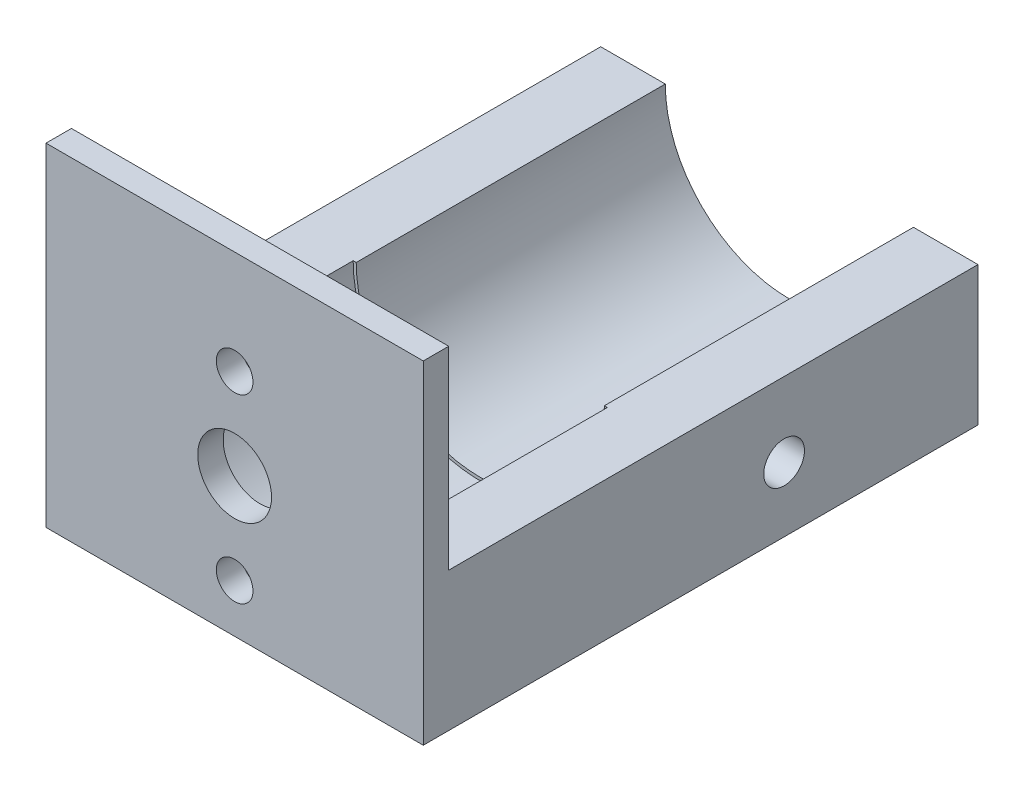
from build123d import *

# Parameters (mm, degrees)
BOSS_EXTRUDE1_DEPTH = 30.364999976
BOSS_EXTRUDE2_DEPTH = 21.63499991
SKETCH4_W           = 37.064796383
SKETCH4_H           = 32.7
SKETCH4_R           = 3.625
SKETCH4_R_2         = 1.8
BOSS_EXTRUDE3_DEPTH = 2.5
SKETCH5_R           = 2
CUT_EXTRUDE1_DEPTH  = 7
SKETCH6_R           = 2.000000064
CUT_EXTRUDE2_DEPTH  = 7
CUT_EXTRUDE3_START  = -7
SKETCH7_R           = 2
CUT_EXTRUDE3_DEPTH  = 7


with BuildPart() as part:
    # Sketch1 → Boss-Extrude1 (new body)
    with BuildSketch(Plane.XY):
        with BuildLine():
            Line((23.763847258, 19.05), (23.763847258, 5.4))
            Line((23.763847258, 5.4), (-13.300949125, 5.4))
            Line((-13.300949125, 5.4), (-13.300949125, 19.05))
            Line((-13.300949125, 19.05), (-6.958949124, 19.05))
            ThreePointArc((-6.958949124, 19.05), (5.231449067, 6.859601809), (17.421847257, 19.05))
            Line((17.421847257, 19.05), (23.763847258, 19.05))
        make_face()
    extrude(amount=BOSS_EXTRUDE1_DEPTH)

    # Sketch3 → Boss-Extrude2 (add)
    with BuildSketch(Plane.XY.offset(30.364999976)):
        with BuildLine():
            Line((-13.300949125, 19.05), (-13.300949125, 5.4))
            Line((-13.300949125, 5.4), (23.763847258, 5.4))
            Line((23.763847258, 5.4), (23.763847258, 19.05))
            Line((23.763847258, 19.05), (17.72184715, 19.05))
            ThreePointArc((17.72184715, 19.05), (5.231449012, 6.559601862), (-7.258949126, 19.05))
            Line((-7.258949126, 19.05), (-13.300949125, 19.05))
        make_face()
    extrude(amount=BOSS_EXTRUDE2_DEPTH)

    # Sketch4 → Boss-Extrude3 (add)
    with BuildSketch(Plane.XY.offset(51.999999886)):
        with Locations((5.231449067, 21.75)):
            Rectangle(SKETCH4_W, SKETCH4_H)
        with Locations((5.231449093, 19.05)):
            Circle(SKETCH4_R, mode=Mode.SUBTRACT)
        with Locations((5.231449093, 10.16)):
            Circle(SKETCH4_R_2, mode=Mode.SUBTRACT)
        with Locations((5.231449093, 27.94)):
            Circle(SKETCH4_R_2, mode=Mode.SUBTRACT)
    extrude(amount=BOSS_EXTRUDE3_DEPTH)

    # Sketch5 → Cut-Extrude1 (cut)
    with BuildSketch(Plane.XZ.offset(-5.4)):
        with Locations((-8.220949125, 48.149999886)):
            Circle(SKETCH5_R)
        with Locations((18.683847258, 48.149999886)):
            Circle(SKETCH5_R)
        with Locations((-8.220949125, 6.35)):
            Circle(SKETCH5_R)
        with Locations((18.683847258, 6.35)):
            Circle(SKETCH5_R)
    extrude(amount=-CUT_EXTRUDE1_DEPTH, mode=Mode.SUBTRACT)

    # Sketch6 → Cut-Extrude2 (cut)
    with BuildSketch(Plane.ZY.offset(13.300949125)):
        with Locations((19.05, 11.75)):
            Circle(SKETCH6_R)
    extrude(amount=-CUT_EXTRUDE2_DEPTH, mode=Mode.SUBTRACT)

    # Sketch7 → Cut-Extrude3 (cut)
    with BuildSketch(Plane(origin=(23.763847258, 0, 0), x_dir=(0, 0, -1), z_dir=(1, 0, 0)).offset(CUT_EXTRUDE3_START)):
        with Locations((-19.05, 11.75)):
            Circle(SKETCH7_R)
    extrude(amount=CUT_EXTRUDE3_DEPTH, mode=Mode.SUBTRACT)


solid = part.part
